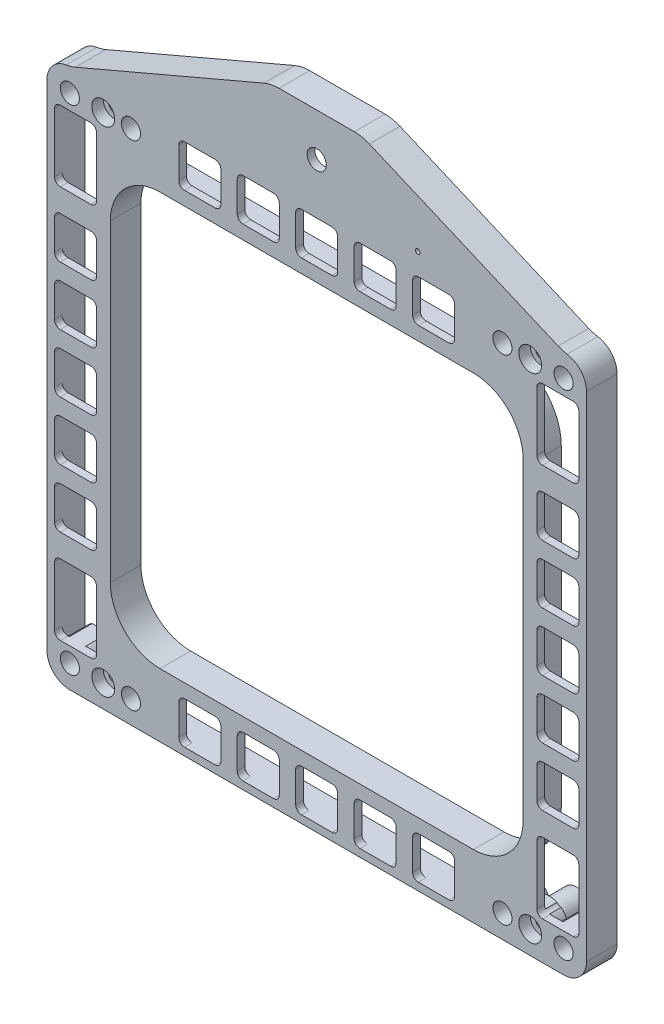
from build123d import *

# Parameters (mm, degrees)
BOSS_EXTRUDE1_DEPTH = 8
SKETCH3_R           = 2.5
SKETCH3_R_2         = 1.6
CUT_EXTRUDE2_DEPTH  = 118.115199697
FILLET1_R           = 10
SKETCH4_R           = 3
CUT_EXTRUDE3_DEPTH  = 3
SHELL1_DEPTH        = 6
SHELL1_2_DEPTH      = 3
CUT_EXTRUDE4_DEPTH  = 118.115199697
CUT_EXTRUDE5_DEPTH  = 118.115199697
SKETCH7_R           = 2.5
CUT_EXTRUDE6_DEPTH  = 118.115199697
BOSS_EXTRUDE2_START = 4
SKETCH8_R           = 3.6
SKETCH8_R_2         = 1.6
BOSS_EXTRUDE2_DEPTH = 4
SKETCH9_R           = 0.6
CUT_EXTRUDE7_DEPTH  = 118.456247173


# Read off the part's stored shape, not the designer's step: Shell1
with BuildPart() as part:
    # Sketch2 → Boss-Extrude1 (new body)
    with BuildSketch(Plane.XY):
        with BuildLine():
            Line((-9.854586018, 93.1), (9.854586018, 93.1))
            ThreePointArc((9.854586018, 93.1), (11.858510235, 92.897157125), (13.781138102, 92.296857547))
            Line((13.781138102, 92.296857547), (64.6, 70.6))
            ThreePointArc((64.6, 70.6), (68.842640687, 68.842640687), (70.6, 64.6))
            Line((70.6, 64.6), (70.6, -64.6))
            ThreePointArc((70.6, -64.6), (68.842640687, -68.842640687), (64.6, -70.6))
            Line((64.6, -70.6), (-64.6, -70.6))
            ThreePointArc((-64.6, -70.6), (-68.842640687, -68.842640687), (-70.6, -64.6))
            Line((-70.6, -64.6), (-70.6, 64.6))
            ThreePointArc((-70.6, 64.6), (-68.842640687, 68.842640687), (-64.6, 70.6))
            Line((-64.6, 70.6), (-13.781138102, 92.296857547))
            ThreePointArc((-13.781138102, 92.296857547), (-11.858510235, 92.897157125), (-9.854586018, 93.1))
        make_face()
        with BuildLine():
            ThreePointArc((-41, 54), (-50.192388155, 50.192388155), (-54, 41))
            Line((-54, 41), (-54, -41))
            ThreePointArc((-54, -41), (-50.192388155, -50.192388155), (-41, -54))
            Line((-41, -54), (41, -54))
            ThreePointArc((41, -54), (50.192388155, -50.192388155), (54, -41))
            Line((54, -41), (54, 41))
            ThreePointArc((54, 41), (50.192388155, 50.192388155), (41, 54))
            Line((41, 54), (-41, 54))
        make_face(mode=Mode.SUBTRACT)
    extrude(amount=BOSS_EXTRUDE1_DEPTH)

    # Sketch3 → Cut-Extrude2 (cut, through all)
    with BuildSketch(Plane.XY):
        with Locations((-64.6, 64.6)):
            Circle(SKETCH3_R)
        with Locations((-48.6, 64.6)):
            Circle(SKETCH3_R)
        with Locations(Location((48.6, 64.6, 0), (0, 0, 180))):
            Circle(SKETCH3_R)
        with Locations(Location((64.6, 64.6, 0), (0, 0, 180))):
            Circle(SKETCH3_R)
        with Locations((64.6, -64.6)):
            Circle(SKETCH3_R)
        with Locations((48.6, -64.6)):
            Circle(SKETCH3_R)
        with Locations(Location((-48.6, -64.6, 0), (0, 0, 180))):
            Circle(SKETCH3_R)
        with Locations(Location((-64.6, -64.6, 0), (0, 0, 180))):
            Circle(SKETCH3_R)
        with Locations((-55.87, 64.6)):
            Circle(SKETCH3_R_2)
        with Locations(Location((-55.87, -64.6, 0), (0, 0, 180))):
            Circle(SKETCH3_R_2)
        with Locations((55.87, -64.6)):
            Circle(SKETCH3_R_2)
        with Locations(Location((55.87, 64.6, 0), (0, 0, 180))):
            Circle(SKETCH3_R_2)
    extrude(amount=CUT_EXTRUDE2_DEPTH, mode=Mode.SUBTRACT)

    # Fillet1
    fillet1_edges = [part.edges().sort_by_distance(p)[0] for p in [
        (64.6, 70.6, 4),
        (-64.6, 70.6, 4),
    ]]
    fillet(fillet1_edges, radius=FILLET1_R)

    # Sketch4 → Cut-Extrude3 (cut)
    with BuildSketch(Plane.XY.offset(8)):
        with Locations((-55.87, 64.6)):
            Circle(SKETCH4_R)
        with Locations(Location((55.87, 64.6, 0), (0, 0, 180))):
            Circle(SKETCH4_R)
        with Locations((55.87, -64.6)):
            Circle(SKETCH4_R)
        with Locations(Location((-55.87, -64.6, 0), (0, 0, 180))):
            Circle(SKETCH4_R)
    extrude(amount=-CUT_EXTRUDE3_DEPTH, mode=Mode.SUBTRACT)

    # Shell1 outline → Shell1 (cut)
    # profile 1 of 5: a face of its own
    with BuildSketch(Plane.XY):
        with BuildLine():
            Line((68.6, -62.538447187), (68.6, 62.538447187))
            ThreePointArc((68.6, 62.538447187), (64.49364716, 60.101256945), (60.507050401, 62.729769111))
            ThreePointArc((60.507050401, 62.729769111), (56.549882486, 59.646439684), (51.908314993, 61.549581683))
            ThreePointArc((51.908314993, 61.549581683), (44.1, 64.6), (51.908314993, 67.650418317))
            ThreePointArc((51.908314993, 67.650418317), (56.549882486, 69.553560316), (60.507050401, 66.470230889))
            ThreePointArc((60.507050401, 66.470230889), (61.715689296, 68.054092032), (63.489713496, 68.960878797))
            ThreePointArc((63.489713496, 68.960878797), (62.938545314, 69.150078801), (62.397212138, 69.365813358))
            Line((62.397212138, 69.365813358), (12.995827685, 90.457486037))
            ThreePointArc((12.995827685, 90.457486037), (11.457725391, 90.9377257), (9.854586018, 91.1))
            Line((9.854586018, 91.1), (-9.854586018, 91.1))
            ThreePointArc((-9.854586018, 91.1), (-11.457725391, 90.9377257), (-12.995827685, 90.457486037))
            Line((-12.995827685, 90.457486037), (-62.397212138, 69.365813358))
            ThreePointArc((-62.397212138, 69.365813358), (-62.938545314, 69.150078801), (-63.489713496, 68.960878797))
            ThreePointArc((-63.489713496, 68.960878797), (-61.715689296, 68.054092032), (-60.507050401, 66.470230889))
            ThreePointArc((-60.507050401, 66.470230889), (-56.549882486, 69.553560316), (-51.908314993, 67.650418317))
            ThreePointArc((-51.908314993, 67.650418317), (-44.1, 64.6), (-51.908314993, 61.549581683))
            ThreePointArc((-51.908314993, 61.549581683), (-56.549882486, 59.646439684), (-60.507050401, 62.729769111))
            ThreePointArc((-60.507050401, 62.729769111), (-64.49364716, 60.101256945), (-68.6, 62.538447187))
            Line((-68.6, 62.538447187), (-68.6, -62.538447187))
            ThreePointArc((-68.6, -62.538447187), (-64.49364716, -60.101256946), (-60.507050401, -62.729769111))
            ThreePointArc((-60.507050401, -62.729769111), (-56.549882486, -59.646439684), (-51.908314993, -61.549581683))
            ThreePointArc((-51.908314993, -61.549581683), (-45.020097264, -61.87340938), (-46.538447187, -68.6))
            Line((-46.538447187, -68.6), (46.538447187, -68.6))
            ThreePointArc((46.538447187, -68.6), (45.020097264, -61.87340938), (51.908314993, -61.549581683))
            ThreePointArc((51.908314993, -61.549581683), (56.549882486, -59.646439684), (60.507050401, -62.729769111))
            ThreePointArc((60.507050401, -62.729769111), (64.49364716, -60.101256946), (68.6, -62.538447187))
        make_face()
        with BuildLine():
            Line((-56, -41), (-56, 41))
            ThreePointArc((-56, 41), (-51.606601718, 51.606601718), (-41, 56))
            Line((-41, 56), (41, 56))
            ThreePointArc((41, 56), (51.606601718, 51.606601718), (56, 41))
            Line((56, 41), (56, -41))
            ThreePointArc((56, -41), (51.606601718, -51.606601718), (41, -56))
            Line((41, -56), (-41, -56))
            ThreePointArc((-41, -56), (-51.606601718, -51.606601718), (-56, -41))
        make_face(mode=Mode.SUBTRACT)
    # profile 2 of 5: a face of its own
    with BuildSketch(Plane.XY):
        with BuildLine():
            ThreePointArc((62.538447187, -68.6), (61.343705465, -67.705888906), (60.507050401, -66.470230889))
            ThreePointArc((60.507050401, -66.470230889), (59.834229285, -67.64711112), (58.87, -68.6))
            Line((58.87, -68.6), (62.538447187, -68.6))
        make_face()
    # profile 3 of 5: a face of its own
    with BuildSketch(Plane.XY):
        with BuildLine():
            Line((50.661552813, -68.6), (52.87, -68.6))
            ThreePointArc((52.87, -68.6), (52.356925723, -68.157851757), (51.908314993, -67.650418317))
            ThreePointArc((51.908314993, -67.650418317), (51.32659062, -68.179902736), (50.661552813, -68.6))
        make_face()
    # profile 4 of 5: a face of its own
    with BuildSketch(Plane.XY):
        with BuildLine():
            ThreePointArc((-58.87, -68.6), (-59.834229285, -67.64711112), (-60.507050401, -66.470230889))
            ThreePointArc((-60.507050401, -66.470230889), (-61.343705465, -67.705888906), (-62.538447187, -68.6))
            Line((-62.538447187, -68.6), (-58.87, -68.6))
        make_face()
    # profile 5 of 5: a face of its own
    with BuildSketch(Plane.XY):
        with BuildLine():
            ThreePointArc((-50.661552813, -68.6), (-51.32659062, -68.179902736), (-51.908314993, -67.650418317))
            ThreePointArc((-51.908314993, -67.650418317), (-52.356925723, -68.157851757), (-52.87, -68.6))
            Line((-52.87, -68.6), (-50.661552813, -68.6))
        make_face()
    extrude(amount=SHELL1_DEPTH, mode=Mode.SUBTRACT)

    # Shell1 2 outline → Shell1 2 (cut)
    with BuildSketch(Plane.XY):
        with BuildLine():
            ThreePointArc((51.908314993, 61.549581683), (56.549882486, 59.646439684), (60.507050401, 62.729769111))
            ThreePointArc((60.507050401, 62.729769111), (60.1, 64.6), (60.507050401, 66.470230889))
            ThreePointArc((60.507050401, 66.470230889), (56.549882486, 69.553560316), (51.908314993, 67.650418317))
            ThreePointArc((51.908314993, 67.650418317), (52.37681982, 67.046555139), (52.736375516, 66.372116698))
            ThreePointArc((52.736375516, 66.372116698), (59.47, 64.6), (52.736375516, 62.827883302))
            ThreePointArc((52.736375516, 62.827883302), (52.37681982, 62.153444861), (51.908314993, 61.549581683))
        make_face()
        with BuildLine():
            ThreePointArc((60.507050401, -66.470230889), (60.1, -64.6), (60.507050401, -62.729769111))
            ThreePointArc((60.507050401, -62.729769111), (56.549882486, -59.646439684), (51.908314993, -61.549581683))
            ThreePointArc((51.908314993, -61.549581683), (52.37681982, -62.153444861), (52.736375516, -62.827883302))
            ThreePointArc((52.736375516, -62.827883302), (59.47, -64.6), (52.736375516, -66.372116698))
            ThreePointArc((52.736375516, -66.372116698), (52.37681982, -67.04655514), (51.908314993, -67.650418317))
            ThreePointArc((51.908314993, -67.650418317), (52.356925723, -68.157851757), (52.87, -68.6))
            Line((52.87, -68.6), (58.87, -68.6))
            ThreePointArc((58.87, -68.6), (59.834229285, -67.64711112), (60.507050401, -66.470230889))
        make_face()
        with BuildLine():
            ThreePointArc((-52.736375516, -62.827883302), (-52.37681982, -62.153444861), (-51.908314993, -61.549581683))
            ThreePointArc((-51.908314993, -61.549581683), (-56.549882486, -59.646439684), (-60.507050401, -62.729769111))
            ThreePointArc((-60.507050401, -62.729769111), (-60.1, -64.6), (-60.507050401, -66.470230889))
            ThreePointArc((-60.507050401, -66.470230889), (-59.834229285, -67.64711112), (-58.87, -68.6))
            Line((-58.87, -68.6), (-52.87, -68.6))
            ThreePointArc((-52.87, -68.6), (-52.356925723, -68.157851757), (-51.908314993, -67.650418317))
            ThreePointArc((-51.908314993, -67.650418317), (-52.37681982, -67.04655514), (-52.736375516, -66.372116698))
            ThreePointArc((-52.736375516, -66.372116698), (-59.47, -64.6), (-52.736375516, -62.827883302))
        make_face()
        with BuildLine():
            ThreePointArc((-60.507050401, 66.470230889), (-60.1, 64.6), (-60.507050401, 62.729769111))
            ThreePointArc((-60.507050401, 62.729769111), (-56.549882486, 59.646439684), (-51.908314993, 61.549581683))
            ThreePointArc((-51.908314993, 61.549581683), (-52.37681982, 62.153444861), (-52.736375516, 62.827883302))
            ThreePointArc((-52.736375516, 62.827883302), (-59.47, 64.6), (-52.736375516, 66.372116698))
            ThreePointArc((-52.736375516, 66.372116698), (-52.37681982, 67.046555139), (-51.908314993, 67.650418317))
            ThreePointArc((-51.908314993, 67.650418317), (-56.549882486, 69.553560316), (-60.507050401, 66.470230889))
        make_face()
    extrude(amount=SHELL1_2_DEPTH, mode=Mode.SUBTRACT)

    # Sketch5 → Cut-Extrude4 (cut, through all)
    with BuildSketch(Plane.XY.offset(8)):
        with BuildLine():
            ThreePointArc((-67.1, 25.1), (-68.160660172, 25.539339828), (-68.6, 26.6))
            Line((-68.6, 26.6), (-68.6, 34.6))
            ThreePointArc((-68.6, 34.6), (-68.160660172, 35.660660172), (-67.1, 36.1))
            Line((-67.1, 36.1), (-59.1, 36.1))
            ThreePointArc((-59.1, 36.1), (-58.039339828, 35.660660172), (-57.6, 34.6))
            Line((-57.6, 34.6), (-57.6, 26.6))
            ThreePointArc((-57.6, 26.6), (-58.039339828, 25.539339828), (-59.1, 25.1))
            Line((-59.1, 25.1), (-67.1, 25.1))
        make_face()
        with BuildLine():
            ThreePointArc((-67.1, 9.8), (-68.160660172, 10.239339828), (-68.6, 11.3))
            Line((-68.6, 11.3), (-68.6, 19.3))
            ThreePointArc((-68.6, 19.3), (-68.160660172, 20.360660172), (-67.1, 20.8))
            Line((-67.1, 20.8), (-59.1, 20.8))
            ThreePointArc((-59.1, 20.8), (-58.039339828, 20.360660172), (-57.6, 19.3))
            Line((-57.6, 19.3), (-57.6, 11.3))
            ThreePointArc((-57.6, 11.3), (-58.039339828, 10.239339828), (-59.1, 9.8))
            Line((-59.1, 9.8), (-67.1, 9.8))
        make_face()
        with BuildLine():
            ThreePointArc((-67.1, -5.5), (-68.160660172, -5.060660172), (-68.6, -4))
            Line((-68.6, -4), (-68.6, 4))
            ThreePointArc((-68.6, 4), (-68.160660172, 5.060660172), (-67.1, 5.5))
            Line((-67.1, 5.5), (-59.1, 5.5))
            ThreePointArc((-59.1, 5.5), (-58.039339828, 5.060660172), (-57.6, 4))
            Line((-57.6, 4), (-57.6, -4))
            ThreePointArc((-57.6, -4), (-58.039339828, -5.060660172), (-59.1, -5.5))
            Line((-59.1, -5.5), (-67.1, -5.5))
        make_face()
        with BuildLine():
            ThreePointArc((-67.1, -20.8), (-68.160660172, -20.360660172), (-68.6, -19.3))
            Line((-68.6, -19.3), (-68.6, -11.3))
            ThreePointArc((-68.6, -11.3), (-68.160660172, -10.239339828), (-67.1, -9.8))
            Line((-67.1, -9.8), (-59.1, -9.8))
            ThreePointArc((-59.1, -9.8), (-58.039339828, -10.239339828), (-57.6, -11.3))
            Line((-57.6, -11.3), (-57.6, -19.3))
            ThreePointArc((-57.6, -19.3), (-58.039339828, -20.360660172), (-59.1, -20.8))
            Line((-59.1, -20.8), (-67.1, -20.8))
        make_face()
        with BuildLine():
            ThreePointArc((-67.1, -36.1), (-68.160660172, -35.660660172), (-68.6, -34.6))
            Line((-68.6, -34.6), (-68.6, -26.6))
            ThreePointArc((-68.6, -26.6), (-68.160660172, -25.539339828), (-67.1, -25.1))
            Line((-67.1, -25.1), (-59.1, -25.1))
            ThreePointArc((-59.1, -25.1), (-58.039339828, -25.539339828), (-57.6, -26.6))
            Line((-57.6, -26.6), (-57.6, -34.6))
            ThreePointArc((-57.6, -34.6), (-58.039339828, -35.660660172), (-59.1, -36.1))
            Line((-59.1, -36.1), (-67.1, -36.1))
        make_face()
        with BuildLine():
            Line((-34.6, -68.6), (-26.6, -68.6))
            ThreePointArc((-26.6, -68.6), (-25.539339828, -68.160660172), (-25.1, -67.1))
            Line((-25.1, -67.1), (-25.1, -59.1))
            ThreePointArc((-25.1, -59.1), (-25.539339828, -58.039339828), (-26.6, -57.6))
            Line((-26.6, -57.6), (-34.6, -57.6))
            ThreePointArc((-34.6, -57.6), (-35.660660172, -58.039339828), (-36.1, -59.1))
            Line((-36.1, -59.1), (-36.1, -67.1))
            ThreePointArc((-36.1, -67.1), (-35.660660172, -68.160660172), (-34.6, -68.6))
        make_face()
        with BuildLine():
            Line((-19.3, -68.6), (-11.3, -68.6))
            ThreePointArc((-11.3, -68.6), (-10.239339828, -68.160660172), (-9.8, -67.1))
            Line((-9.8, -67.1), (-9.8, -59.1))
            ThreePointArc((-9.8, -59.1), (-10.239339828, -58.039339828), (-11.3, -57.6))
            Line((-11.3, -57.6), (-19.3, -57.6))
            ThreePointArc((-19.3, -57.6), (-20.360660172, -58.039339828), (-20.8, -59.1))
            Line((-20.8, -59.1), (-20.8, -67.1))
            ThreePointArc((-20.8, -67.1), (-20.360660172, -68.160660172), (-19.3, -68.6))
        make_face()
        with BuildLine():
            Line((-4, -68.6), (4, -68.6))
            ThreePointArc((4, -68.6), (5.060660172, -68.160660172), (5.5, -67.1))
            Line((5.5, -67.1), (5.5, -59.1))
            ThreePointArc((5.5, -59.1), (5.060660172, -58.039339828), (4, -57.6))
            Line((4, -57.6), (-4, -57.6))
            ThreePointArc((-4, -57.6), (-5.060660172, -58.039339828), (-5.5, -59.1))
            Line((-5.5, -59.1), (-5.5, -67.1))
            ThreePointArc((-5.5, -67.1), (-5.060660172, -68.160660172), (-4, -68.6))
        make_face()
        with BuildLine():
            Line((11.3, -68.6), (19.3, -68.6))
            ThreePointArc((19.3, -68.6), (20.360660172, -68.160660172), (20.8, -67.1))
            Line((20.8, -67.1), (20.8, -59.1))
            ThreePointArc((20.8, -59.1), (20.360660172, -58.039339828), (19.3, -57.6))
            Line((19.3, -57.6), (11.3, -57.6))
            ThreePointArc((11.3, -57.6), (10.239339828, -58.039339828), (9.8, -59.1))
            Line((9.8, -59.1), (9.8, -67.1))
            ThreePointArc((9.8, -67.1), (10.239339828, -68.160660172), (11.3, -68.6))
        make_face()
        with BuildLine():
            Line((26.6, -68.6), (34.6, -68.6))
            ThreePointArc((34.6, -68.6), (35.660660172, -68.160660172), (36.1, -67.1))
            Line((36.1, -67.1), (36.1, -59.1))
            ThreePointArc((36.1, -59.1), (35.660660172, -58.039339828), (34.6, -57.6))
            Line((34.6, -57.6), (26.6, -57.6))
            ThreePointArc((26.6, -57.6), (25.539339828, -58.039339828), (25.1, -59.1))
            Line((25.1, -59.1), (25.1, -67.1))
            ThreePointArc((25.1, -67.1), (25.539339828, -68.160660172), (26.6, -68.6))
        make_face()
        with BuildLine():
            Line((68.6, -34.6), (68.6, -26.6))
            ThreePointArc((68.6, -26.6), (68.160660172, -25.539339828), (67.1, -25.1))
            Line((67.1, -25.1), (59.1, -25.1))
            ThreePointArc((59.1, -25.1), (58.039339828, -25.539339828), (57.6, -26.6))
            Line((57.6, -26.6), (57.6, -34.6))
            ThreePointArc((57.6, -34.6), (58.039339828, -35.660660172), (59.1, -36.1))
            Line((59.1, -36.1), (67.1, -36.1))
            ThreePointArc((67.1, -36.1), (68.160660172, -35.660660172), (68.6, -34.6))
        make_face()
        with BuildLine():
            Line((68.6, -19.3), (68.6, -11.3))
            ThreePointArc((68.6, -11.3), (68.160660172, -10.239339828), (67.1, -9.8))
            Line((67.1, -9.8), (59.1, -9.8))
            ThreePointArc((59.1, -9.8), (58.039339828, -10.239339828), (57.6, -11.3))
            Line((57.6, -11.3), (57.6, -19.3))
            ThreePointArc((57.6, -19.3), (58.039339828, -20.360660172), (59.1, -20.8))
            Line((59.1, -20.8), (67.1, -20.8))
            ThreePointArc((67.1, -20.8), (68.160660172, -20.360660172), (68.6, -19.3))
        make_face()
        with BuildLine():
            Line((68.6, -4), (68.6, 4))
            ThreePointArc((68.6, 4), (68.160660172, 5.060660172), (67.1, 5.5))
            Line((67.1, 5.5), (59.1, 5.5))
            ThreePointArc((59.1, 5.5), (58.039339828, 5.060660172), (57.6, 4))
            Line((57.6, 4), (57.6, -4))
            ThreePointArc((57.6, -4), (58.039339828, -5.060660172), (59.1, -5.5))
            Line((59.1, -5.5), (67.1, -5.5))
            ThreePointArc((67.1, -5.5), (68.160660172, -5.060660172), (68.6, -4))
        make_face()
        with BuildLine():
            Line((68.6, 11.3), (68.6, 19.3))
            ThreePointArc((68.6, 19.3), (68.160660172, 20.360660172), (67.1, 20.8))
            Line((67.1, 20.8), (59.1, 20.8))
            ThreePointArc((59.1, 20.8), (58.039339828, 20.360660172), (57.6, 19.3))
            Line((57.6, 19.3), (57.6, 11.3))
            ThreePointArc((57.6, 11.3), (58.039339828, 10.239339828), (59.1, 9.8))
            Line((59.1, 9.8), (67.1, 9.8))
            ThreePointArc((67.1, 9.8), (68.160660172, 10.239339828), (68.6, 11.3))
        make_face()
        with BuildLine():
            Line((68.6, 26.6), (68.6, 34.6))
            ThreePointArc((68.6, 34.6), (68.160660172, 35.660660172), (67.1, 36.1))
            Line((67.1, 36.1), (59.1, 36.1))
            ThreePointArc((59.1, 36.1), (58.039339828, 35.660660172), (57.6, 34.6))
            Line((57.6, 34.6), (57.6, 26.6))
            ThreePointArc((57.6, 26.6), (58.039339828, 25.539339828), (59.1, 25.1))
            Line((59.1, 25.1), (67.1, 25.1))
            ThreePointArc((67.1, 25.1), (68.160660172, 25.539339828), (68.6, 26.6))
        make_face()
        with BuildLine():
            ThreePointArc((25.1, 67.1), (25.539339828, 68.160660172), (26.6, 68.6))
            Line((26.6, 68.6), (34.6, 68.6))
            ThreePointArc((34.6, 68.6), (35.660660172, 68.160660172), (36.1, 67.1))
            Line((36.1, 67.1), (36.1, 59.1))
            ThreePointArc((36.1, 59.1), (35.660660172, 58.039339828), (34.6, 57.6))
            Line((34.6, 57.6), (26.6, 57.6))
            ThreePointArc((26.6, 57.6), (25.539339828, 58.039339828), (25.1, 59.1))
            Line((25.1, 59.1), (25.1, 67.1))
        make_face()
        with BuildLine():
            ThreePointArc((9.8, 67.1), (10.239339828, 68.160660172), (11.3, 68.6))
            Line((11.3, 68.6), (19.3, 68.6))
            ThreePointArc((19.3, 68.6), (20.360660172, 68.160660172), (20.8, 67.1))
            Line((20.8, 67.1), (20.8, 59.1))
            ThreePointArc((20.8, 59.1), (20.360660172, 58.039339828), (19.3, 57.6))
            Line((19.3, 57.6), (11.3, 57.6))
            ThreePointArc((11.3, 57.6), (10.239339828, 58.039339828), (9.8, 59.1))
            Line((9.8, 59.1), (9.8, 67.1))
        make_face()
        with BuildLine():
            ThreePointArc((-5.5, 67.1), (-5.060660172, 68.160660172), (-4, 68.6))
            Line((-4, 68.6), (4, 68.6))
            ThreePointArc((4, 68.6), (5.060660172, 68.160660172), (5.5, 67.1))
            Line((5.5, 67.1), (5.5, 59.1))
            ThreePointArc((5.5, 59.1), (5.060660172, 58.039339828), (4, 57.6))
            Line((4, 57.6), (-4, 57.6))
            ThreePointArc((-4, 57.6), (-5.060660172, 58.039339828), (-5.5, 59.1))
            Line((-5.5, 59.1), (-5.5, 67.1))
        make_face()
        with BuildLine():
            ThreePointArc((-20.8, 67.1), (-20.360660172, 68.160660172), (-19.3, 68.6))
            Line((-19.3, 68.6), (-11.3, 68.6))
            ThreePointArc((-11.3, 68.6), (-10.239339828, 68.160660172), (-9.8, 67.1))
            Line((-9.8, 67.1), (-9.8, 59.1))
            ThreePointArc((-9.8, 59.1), (-10.239339828, 58.039339828), (-11.3, 57.6))
            Line((-11.3, 57.6), (-19.3, 57.6))
            ThreePointArc((-19.3, 57.6), (-20.360660172, 58.039339828), (-20.8, 59.1))
            Line((-20.8, 59.1), (-20.8, 67.1))
        make_face()
        with BuildLine():
            ThreePointArc((-36.1, 67.1), (-35.660660172, 68.160660172), (-34.6, 68.6))
            Line((-34.6, 68.6), (-26.6, 68.6))
            ThreePointArc((-26.6, 68.6), (-25.539339828, 68.160660172), (-25.1, 67.1))
            Line((-25.1, 67.1), (-25.1, 59.1))
            ThreePointArc((-25.1, 59.1), (-25.539339828, 58.039339828), (-26.6, 57.6))
            Line((-26.6, 57.6), (-34.6, 57.6))
            ThreePointArc((-34.6, 57.6), (-35.660660172, 58.039339828), (-36.1, 59.1))
            Line((-36.1, 59.1), (-36.1, 67.1))
        make_face()
    extrude(amount=-CUT_EXTRUDE4_DEPTH, mode=Mode.SUBTRACT)

    # Sketch6 → Cut-Extrude5 (cut, through all)
    with BuildSketch(Plane.XY.offset(8)):
        with BuildLine():
            Line((-67.1, 42.15), (-59.1, 42.15))
            ThreePointArc((-59.1, 42.15), (-58.039339828, 42.589339828), (-57.6, 43.65))
            Line((-57.6, 43.65), (-57.6, 59.15))
            ThreePointArc((-57.6, 59.15), (-58.039339828, 60.210660172), (-59.1, 60.65))
            Line((-59.1, 60.65), (-67.1, 60.65))
            ThreePointArc((-67.1, 60.65), (-68.160660172, 60.210660172), (-68.6, 59.15))
            Line((-68.6, 59.15), (-68.6, 43.65))
            ThreePointArc((-68.6, 43.65), (-68.160660172, 42.589339828), (-67.1, 42.15))
        make_face()
        with BuildLine():
            Line((57.6, 43.65), (57.6, 59.15))
            ThreePointArc((57.6, 59.15), (58.039339828, 60.210660172), (59.1, 60.65))
            Line((59.1, 60.65), (67.1, 60.65))
            ThreePointArc((67.1, 60.65), (68.160660172, 60.210660172), (68.6, 59.15))
            Line((68.6, 59.15), (68.6, 43.65))
            ThreePointArc((68.6, 43.65), (68.160660172, 42.589339828), (67.1, 42.15))
            Line((67.1, 42.15), (59.1, 42.15))
            ThreePointArc((59.1, 42.15), (58.039339828, 42.589339828), (57.6, 43.65))
        make_face()
        with BuildLine():
            Line((67.1, -42.15), (59.1, -42.15))
            ThreePointArc((59.1, -42.15), (58.039339828, -42.589339828), (57.6, -43.65))
            Line((57.6, -43.65), (57.6, -59.15))
            ThreePointArc((57.6, -59.15), (58.039339828, -60.210660172), (59.1, -60.65))
            Line((59.1, -60.65), (67.1, -60.65))
            ThreePointArc((67.1, -60.65), (68.160660172, -60.210660172), (68.6, -59.15))
            Line((68.6, -59.15), (68.6, -43.65))
            ThreePointArc((68.6, -43.65), (68.160660172, -42.589339828), (67.1, -42.15))
        make_face()
        with BuildLine():
            Line((-57.6, -43.65), (-57.6, -59.15))
            ThreePointArc((-57.6, -59.15), (-58.039339828, -60.210660172), (-59.1, -60.65))
            Line((-59.1, -60.65), (-67.1, -60.65))
            ThreePointArc((-67.1, -60.65), (-68.160660172, -60.210660172), (-68.6, -59.15))
            Line((-68.6, -59.15), (-68.6, -43.65))
            ThreePointArc((-68.6, -43.65), (-68.160660172, -42.589339828), (-67.1, -42.15))
            Line((-67.1, -42.15), (-59.1, -42.15))
            ThreePointArc((-59.1, -42.15), (-58.039339828, -42.589339828), (-57.6, -43.65))
        make_face()
    extrude(amount=-CUT_EXTRUDE5_DEPTH, mode=Mode.SUBTRACT)

    # Sketch7 → Cut-Extrude6 (cut, through all)
    with BuildSketch(Plane.XY.offset(8)):
        with Locations((0, 81.85)):
            Circle(SKETCH7_R)
    extrude(amount=-CUT_EXTRUDE6_DEPTH, mode=Mode.SUBTRACT)

    # Sketch8 → Boss-Extrude2 (add)
    # profile 1 of 4: a face of its own
    with BuildSketch(Plane(origin=(0, 0, 0), x_dir=(-1, 0, 0), z_dir=(0, 0, -1)).offset(BOSS_EXTRUDE2_START)):
        with Locations((-55.87, 64.6)):
            Circle(SKETCH8_R)
        with Locations((-55.87, 64.6)):
            Circle(SKETCH8_R_2, mode=Mode.SUBTRACT)
    # profile 2 of 4: a face of its own
    with BuildSketch(Plane(origin=(0, 0, 0), x_dir=(-1, 0, 0), z_dir=(0, 0, -1)).offset(BOSS_EXTRUDE2_START)):
        with Locations(Location((-55.87, -64.6, 0), (0, 0, 29.488880443))):
            Circle(SKETCH8_R)
        with Locations(Location((-55.87, -64.6, 0), (0, 0, 180))):
            Circle(SKETCH8_R_2, mode=Mode.SUBTRACT)
    # profile 3 of 4: a face of its own
    with BuildSketch(Plane(origin=(0, 0, 0), x_dir=(-1, 0, 0), z_dir=(0, 0, -1)).offset(BOSS_EXTRUDE2_START)):
        with Locations((55.87, -64.6)):
            Circle(SKETCH8_R)
        with Locations((55.87, -64.6)):
            Circle(SKETCH8_R_2, mode=Mode.SUBTRACT)
    # profile 4 of 4: a face of its own
    with BuildSketch(Plane(origin=(0, 0, 0), x_dir=(-1, 0, 0), z_dir=(0, 0, -1)).offset(BOSS_EXTRUDE2_START)):
        with Locations(Location((55.87, 64.6, 0), (0, 0, 150.511119557))):
            Circle(SKETCH8_R)
        with Locations(Location((55.87, 64.6, 0), (0, 0, 180))):
            Circle(SKETCH8_R_2, mode=Mode.SUBTRACT)
    extrude(amount=-BOSS_EXTRUDE2_DEPTH)

    # Sketch9 → Cut-Extrude7 (cut, through all)
    with BuildSketch(Plane.XY.offset(8)):
        with Locations((26.428961387, 74.25)):
            Circle(SKETCH9_R)
    extrude(amount=-CUT_EXTRUDE7_DEPTH, mode=Mode.SUBTRACT)


solid = part.part
